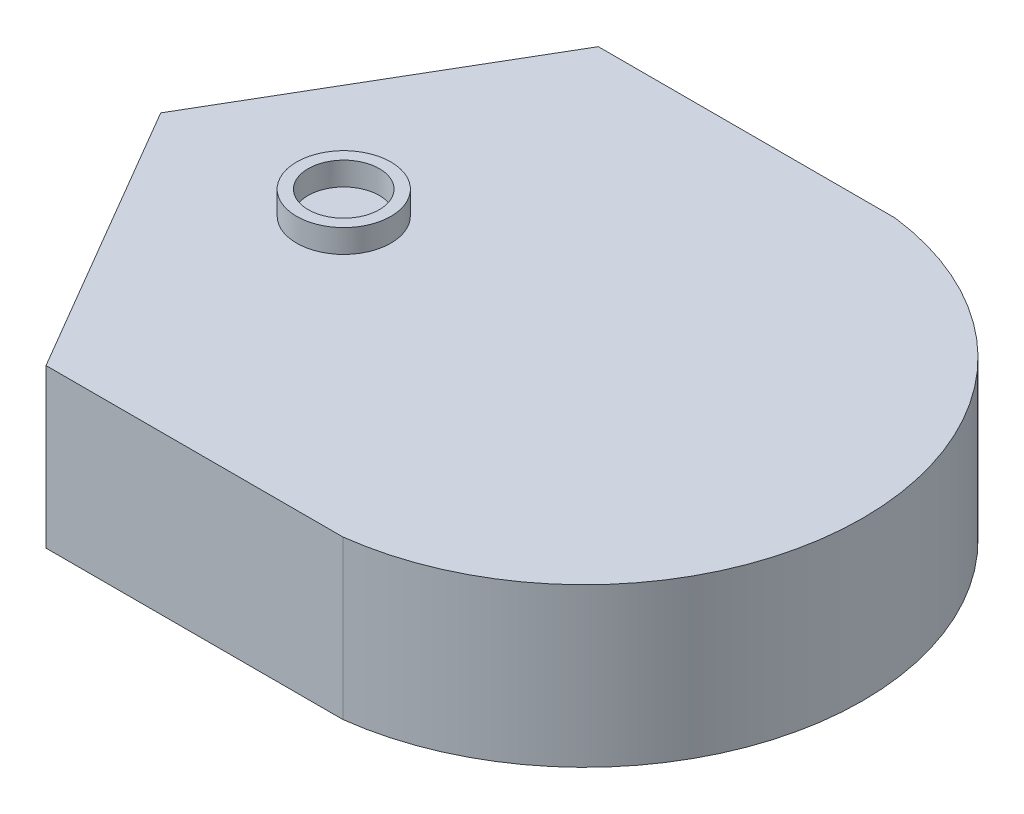
from build123d import *

# Parameters (mm, degrees)
SKETCH2_W            = 49
SKETCH2_H            = 20
BOSS_EXTRUDE1_DEPTH  = 10
SKETCH3_W            = 30
SKETCH3_H            = 3.02
CUT_EXTRUDE1_DEPTH   = 2
SKETCH4_W            = 5
SKETCH4_H            = 6
CUT_EXTRUDE2_DEPTH   = 5
SKETCH5_R            = 7
CUT_EXTRUDE3_DEPTH   = 38.474986727
SKETCH12_W           = 5
SKETCH12_H           = 6
BOSS_EXTRUDE4_DEPTH  = 0.8
SKETCH14_W           = 29.5
SKETCH14_H           = 6
CUT_EXTRUDE6_DEPTH   = 42.177221974
SKETCH20_W           = 5
SKETCH20_H           = 6
BOSS_EXTRUDE6_DEPTH  = 4.2
SKETCH21_R           = 4.6
CUT_EXTRUDE8_DEPTH   = 0.5
SKETCH22_R           = 3.825
CUT_EXTRUDE9_DEPTH   = 4
SKETCH24_R           = 4.6
SKETCH24_R_2         = 4.25
CUT_EXTRUDE11_DEPTH  = 1
BOSS_EXTRUDE9_START  = 8
SKETCH26_R           = 5.065639608
SKETCH26_R_2         = 3.825
BOSS_EXTRUDE9_DEPTH  = 8
SKETCH27_R           = 7
SKETCH27_R_2         = 4.6
CUT_EXTRUDE12_DEPTH  = 1
FILLET1_R            = 0.5
SKETCH56_R           = 2
CUT_EXTRUDE13_DEPTH  = 2
SKETCH57_W           = 3
SKETCH57_H           = 6
BOSS_EXTRUDE19_DEPTH = 5.3
CUT_EXTRUDE14_REACH  = 50.729
SKETCH58_R           = 1.5
FILLET2_R            = 0.3
FILLET3_R            = 0.8
SKETCH60_W           = 19
SKETCH60_H           = 4
BOSS_EXTRUDE21_DEPTH = 1
SKETCH59_W           = 22.86
SKETCH59_H           = 13
BOSS_EXTRUDE20_DEPTH = 11
CUT_EXTRUDE15_REACH  = 49.914
SKETCH61_R           = 2.5
FILLET4_R            = 4
BOSS_EXTRUDE22_DEPTH = 17


with BuildPart() as part:
    # Sketch2 → Boss-Extrude1 (new body)
    with BuildSketch(Plane(origin=(0, 0, 0), x_dir=(1, 0, 0), z_dir=(0, 1, 0))):
        with Locations((10.076923077, 3.557692308)):
            Rectangle(SKETCH2_W, SKETCH2_H)
    extrude(amount=BOSS_EXTRUDE1_DEPTH)

    # Sketch3 → Cut-Extrude1 (cut)
    with BuildSketch(Plane.XZ):
        with Locations((12.576923077, -3.557692308)):
            Rectangle(SKETCH3_W, SKETCH3_H)
    extrude(amount=-CUT_EXTRUDE1_DEPTH, mode=Mode.SUBTRACT)

    # Sketch4 → Cut-Extrude2 (cut)
    with BuildSketch(Plane.XZ):
        with Locations((-4.923076923, -3.547692308)):
            Rectangle(SKETCH4_W, SKETCH4_H)
    extrude(amount=-CUT_EXTRUDE2_DEPTH, mode=Mode.SUBTRACT)

    # Sketch5 → Cut-Extrude3 (cut, through all)
    with BuildSketch(Plane.XZ.offset(-5)):
        with Locations(Location((-4.923076923, -3.552692308, 0), (0, 0, 270))):
            Circle(SKETCH5_R)
    extrude(amount=-CUT_EXTRUDE3_DEPTH, mode=Mode.SUBTRACT)

    # Sketch12 → Boss-Extrude4 (add)
    with BuildSketch(Plane.XZ):
        with Locations((-4.923076923, -3.547692308)):
            Rectangle(SKETCH12_W, SKETCH12_H)
    extrude(amount=-BOSS_EXTRUDE4_DEPTH)

    # Sketch14 → Cut-Extrude6 (cut, through all)
    with BuildSketch(Plane.XY.offset(6.442307692)):
        with Locations((19.826923077, 7)):
            Rectangle(SKETCH14_W, SKETCH14_H)
    extrude(amount=-CUT_EXTRUDE6_DEPTH, mode=Mode.SUBTRACT)

    # Sketch20 → Boss-Extrude6 (add)
    with BuildSketch(Plane(origin=(0, 0.8, 0), x_dir=(1, 0, 0), z_dir=(0, 1, 0))):
        with Locations((-4.923076923, 3.547692308)):
            Rectangle(SKETCH20_W, SKETCH20_H)
    extrude(amount=BOSS_EXTRUDE6_DEPTH)

    # Sketch21 → Cut-Extrude8 (cut)
    with BuildSketch(Plane(origin=(0, 5, 0), x_dir=(1, 0, 0), z_dir=(0, 1, 0))):
        with Locations(Location((-4.923076923, 3.552692308, 0), (0, 0, 270))):
            Circle(SKETCH21_R)
    extrude(amount=-CUT_EXTRUDE8_DEPTH, mode=Mode.SUBTRACT)

    # Sketch22 → Cut-Extrude9 (cut)
    with BuildSketch(Plane(origin=(0, 4.5, 0), x_dir=(1, 0, 0), z_dir=(0, 1, 0))):
        with Locations(Location((-4.923076923, 3.552692308, 0), (0, 0, 270))):
            Circle(SKETCH22_R)
    extrude(amount=-CUT_EXTRUDE9_DEPTH, mode=Mode.SUBTRACT)

    # Sketch24 → Cut-Extrude11 (cut)
    with BuildSketch(Plane(origin=(0, 5, 0), x_dir=(1, 0, 0), z_dir=(0, 1, 0))):
        with Locations(Location((-4.923076923, 3.552692308, 0), (0, 0, 270))):
            Circle(SKETCH24_R)
        with Locations(Location((-4.923076923, 3.552692308, 0), (0, 0, 270))):
            Circle(SKETCH24_R_2, mode=Mode.SUBTRACT)
    extrude(amount=-CUT_EXTRUDE11_DEPTH, mode=Mode.SUBTRACT)

    # Sketch26 → Boss-Extrude9 (add)
    with BuildSketch(Plane(origin=(0, 4.5, 0), x_dir=(1, 0, 0), z_dir=(0, 1, 0)).offset(BOSS_EXTRUDE9_START)):
        with Locations(Location((-4.923076923, 3.552692308, 0), (0, 0, 90))):
            Circle(SKETCH26_R)
        with Locations(Location((-4.923076923, 3.552692308, 0), (0, 0, 270))):
            Circle(SKETCH26_R_2, mode=Mode.SUBTRACT)
    extrude(amount=-BOSS_EXTRUDE9_DEPTH)

    # Sketch27 → Cut-Extrude12 (cut)
    with BuildSketch(Plane(origin=(0, 5, 0), x_dir=(1, 0, 0), z_dir=(0, 1, 0))):
        with Locations(Location((-4.923076923, 3.552692308, 0), (0, 0, 90))):
            Circle(SKETCH27_R)
        with Locations(Location((-4.923076923, 3.552692308, 0), (0, 0, 270))):
            Circle(SKETCH27_R_2, mode=Mode.SUBTRACT)
    extrude(amount=-CUT_EXTRUDE12_DEPTH, mode=Mode.SUBTRACT)

    # Fillet1
    fillet1_edges = [part.edges().sort_by_distance(p)[0] for p in [
        (5.076923077, 4, -3.557692308),
    ]]
    fillet(fillet1_edges, radius=FILLET1_R)

    # Sketch56 → Cut-Extrude13 (cut)
    with BuildSketch(Plane.XZ):
        with Locations((28.926923077, -3.557692308)):
            Circle(SKETCH56_R)
    extrude(amount=-CUT_EXTRUDE13_DEPTH, mode=Mode.SUBTRACT)

    # Sketch57 → Boss-Extrude19 (add)
    with BuildSketch(Plane(origin=(0, 4, 0), x_dir=(1, 0, 0), z_dir=(0, 1, 0))):
        with Locations((29.181923077, 3.557692308)):
            Rectangle(SKETCH57_W, SKETCH57_H)
        with Locations((22.931923077, 3.557692308)):
            Rectangle(SKETCH57_W, SKETCH57_H)
    extrude(amount=BOSS_EXTRUDE19_DEPTH)

    # Cut-Extrude14: up to this face of the body (flat: up to its plane)
    cut_extrude14_end = Plane(part.part.faces().sort_by_distance((21.431923077, 6.65, -3.557692308))[0])
    # Sketch58 → Cut-Extrude14 (cut, up to the picked face)
    with BuildSketch(Plane(origin=(30.681923077, 0, 0), x_dir=(0, 0, -1), z_dir=(1, 0, 0)), mode=Mode.PRIVATE) as cut_extrude14_sk1:
        with Locations(Location((3.557692308, 7, 0), (0, 0, 180))):
            Circle(SKETCH58_R)
    cut_extrude14_tool1 = split(extrude(cut_extrude14_sk1.sketch, amount=-CUT_EXTRUDE14_REACH, mode=Mode.PRIVATE), bisect_by=cut_extrude14_end, keep=Keep.BOTH, mode=Mode.PRIVATE)
    add(cut_extrude14_tool1.solids().sort_by(Axis((30.681923, 7, -3.557692), (-1, 0, 0)))[0], mode=Mode.SUBTRACT)

    # Fillet2
    fillet2_edges = [part.edges().sort_by_distance(p)[0] for p in [
        (27.681923077, 9.3, -3.557692308),
        (24.431923077, 9.3, -3.557692308),
    ]]
    fillet(fillet2_edges, radius=FILLET2_R)

    # Fillet3
    fillet3_edges = [part.edges().sort_by_distance(p)[0] for p in [
        (30.681923077, 4, -3.557692308),
        (30.681923077, 6.65, -0.557692308),
        (29.181923077, 4, -6.557692308),
        (30.681923077, 6.65, -6.557692308),
        (29.181923077, 4, -0.557692308),
        (21.431923077, 6.65, -6.557692308),
        (21.431923077, 6.65, -0.557692308),
        (22.931923077, 4, -6.557692308),
        (21.431923077, 4, -3.557692308),
        (22.931923077, 4, -0.557692308),
    ]]
    fillet(fillet3_edges, radius=FILLET3_R)

    # Sketch60 → Boss-Extrude21 (add)
    with BuildSketch(Plane(origin=(0, 0, -13.557692308), x_dir=(-1, 0, 0), z_dir=(0, 0, -1))):
        with Locations((-25.076923077, 2)):
            Rectangle(SKETCH60_W, SKETCH60_H)
    boss_extrude21 = extrude(amount=BOSS_EXTRUDE21_DEPTH)

    # Sketch59 → Boss-Extrude20 (add)
    with BuildSketch(Plane(origin=(0, 0, -14.557692308), x_dir=(-1, 0, 0), z_dir=(0, 0, -1))):
        with Locations((-26.956923077, 3.5)):
            Rectangle(SKETCH59_W, SKETCH59_H)
    boss_extrude20 = extrude(amount=BOSS_EXTRUDE20_DEPTH)

    # Mirror4: Boss-Extrude21, Boss-Extrude20 across plane
    add(boss_extrude21.mirror(Plane(origin=(0, 0, -3.557692308), x_dir=(1, 0, 0), z_dir=(0, 0, -1))))
    add(boss_extrude20.mirror(Plane(origin=(0, 0, -3.557692308), x_dir=(1, 0, 0), z_dir=(0, 0, -1))))

    # Sketch61 → Cut-Extrude15 (cut, up to next)
    with BuildSketch(Plane(origin=(0, 10, 0), x_dir=(1, 0, 0), z_dir=(0, 1, 0)), mode=Mode.PRIVATE) as cut_extrude15_sk1:
        with Locations(Location((20.406923077, 20.207692308, 0), (0, 0, 270))):
            Circle(SKETCH61_R)
    cut_extrude15_tool1 = extrude(cut_extrude15_sk1.sketch, amount=-CUT_EXTRUDE15_REACH, mode=Mode.PRIVATE) & part.part
    # Sketch61 → Cut-Extrude15 (cut, up to next)
    with BuildSketch(Plane(origin=(0, 10, 0), x_dir=(1, 0, 0), z_dir=(0, 1, 0)), mode=Mode.PRIVATE) as cut_extrude15_sk2:
        with Locations(Location((31.706923077, 20.207692308, 0), (0, 0, 270))):
            Circle(SKETCH61_R)
    cut_extrude15_tool2 = extrude(cut_extrude15_sk2.sketch, amount=-CUT_EXTRUDE15_REACH, mode=Mode.PRIVATE) & part.part
    # Sketch61 → Cut-Extrude15 (cut, up to next)
    with BuildSketch(Plane(origin=(0, 10, 0), x_dir=(1, 0, 0), z_dir=(0, 1, 0)), mode=Mode.PRIVATE) as cut_extrude15_sk3:
        with Locations(Location((31.706923077, -13.092307692, 0), (0, 0, 90))):
            Circle(SKETCH61_R)
    cut_extrude15_tool3 = extrude(cut_extrude15_sk3.sketch, amount=-CUT_EXTRUDE15_REACH, mode=Mode.PRIVATE) & part.part
    # Sketch61 → Cut-Extrude15 (cut, up to next)
    with BuildSketch(Plane(origin=(0, 10, 0), x_dir=(1, 0, 0), z_dir=(0, 1, 0)), mode=Mode.PRIVATE) as cut_extrude15_sk4:
        with Locations(Location((20.406923077, -13.092307692, 0), (0, 0, 90))):
            Circle(SKETCH61_R)
    cut_extrude15_tool4 = extrude(cut_extrude15_sk4.sketch, amount=-CUT_EXTRUDE15_REACH, mode=Mode.PRIVATE) & part.part
    add(cut_extrude15_tool1.solids().sort_by_distance((20.406923, 10, -20.207692))[0], mode=Mode.SUBTRACT)
    add(cut_extrude15_tool2.solids().sort_by_distance((31.706923, 10, -20.207692))[0], mode=Mode.SUBTRACT)
    add(cut_extrude15_tool3.solids().sort_by_distance((31.706923, 10, 13.092308))[0], mode=Mode.SUBTRACT)
    add(cut_extrude15_tool4.solids().sort_by_distance((20.406923, 10, 13.092308))[0], mode=Mode.SUBTRACT)

    # Fillet4
    # the kernel refuses this fillet: 4 mm, written as the material it takes off along each edge
    with BuildSketch(Plane(origin=(38.386923077, 20, -25.557692308), x_dir=(0, 0, 1), z_dir=(0, -1, 0)), Plane(origin=(15.526923077, -13, -25.557692308), x_dir=(0, 0, 1), z_dir=(0, 1, 0)), Plane(origin=(15.526923077, -13, 18.442307692), x_dir=(1, 0, 0), z_dir=(0, 1, 0))) as fillet4_piece_1:
        with BuildLine():
            CenterArc((FILLET4_R, FILLET4_R), FILLET4_R, 180, 90)
            Line((0, FILLET4_R), (0, 0))
            Line((0, 0), (FILLET4_R, 0))
        make_face()
    extrude(amount=33, mode=Mode.SUBTRACT)
    with BuildSketch(Plane(origin=(38.386923077, 20, -14.557692308), x_dir=(-1, 0, 0), z_dir=(0, -1, 0))) as fillet4_piece_2_section:
        with BuildLine():
            CenterArc((FILLET4_R, FILLET4_R), FILLET4_R, 180, 90)
            Line((0, FILLET4_R), (0, 0))
            Line((0, 0), (FILLET4_R, 0))
        make_face()
    fillet4_piece_2 = extrude(amount=33, mode=Mode.PRIVATE)
    fillet4_piece_2 = split(fillet4_piece_2, bisect_by=Plane(origin=(34.576923077, 12, -14.51845576), z_dir=(-1, 0, 0)), keep=Keep.TOP, mode=Mode.PRIVATE)
    fillet4_piece_2 = split(fillet4_piece_2, bisect_by=Plane(origin=(34.482800084, 4, -14.51845576), z_dir=(0, 1, 0)), keep=Keep.TOP, mode=Mode.PRIVATE)
    add(fillet4_piece_2, mode=Mode.SUBTRACT)
    with BuildSketch(Plane(origin=(38.386923077, 20, -14.557692308), x_dir=(-1, 0, 0), z_dir=(0, -1, 0))) as fillet4_piece_3_section:
        with BuildLine():
            CenterArc((FILLET4_R, FILLET4_R), FILLET4_R, 180, 90)
            Line((0, FILLET4_R), (0, 0))
            Line((0, 0), (FILLET4_R, 0))
        make_face()
    fillet4_piece_3 = extrude(amount=33, mode=Mode.PRIVATE)
    fillet4_piece_3 = split(fillet4_piece_3, bisect_by=Plane(origin=(34.576923077, 12, -15.466872512), z_dir=(1, 0, 0)), keep=Keep.TOP, mode=Mode.PRIVATE)
    fillet4_piece_3 = split(fillet4_piece_3, bisect_by=Plane(origin=(37.49276705, 4, -15.466872512), z_dir=(0, 1, 0)), keep=Keep.TOP, mode=Mode.PRIVATE)
    add(fillet4_piece_3, mode=Mode.SUBTRACT)
    with BuildSketch(Plane(origin=(38.386923077, 20, -14.557692308), x_dir=(-1, 0, 0), z_dir=(0, -1, 0))) as fillet4_piece_4_section:
        with BuildLine():
            CenterArc((FILLET4_R, FILLET4_R), FILLET4_R, 180, 90)
            Line((0, FILLET4_R), (0, 0))
            Line((0, 0), (FILLET4_R, 0))
        make_face()
    fillet4_piece_4 = extrude(amount=33, mode=Mode.PRIVATE)
    fillet4_piece_4 = split(fillet4_piece_4, bisect_by=Plane(origin=(34.576923077, 2, -15.466872512), z_dir=(1, 0, 0)), keep=Keep.TOP, mode=Mode.PRIVATE)
    fillet4_piece_4 = split(fillet4_piece_4, bisect_by=Plane(origin=(37.49276705, 0, -15.466872512), z_dir=(0, 1, 0)), keep=Keep.TOP, mode=Mode.PRIVATE)
    fillet4_piece_4 = split(fillet4_piece_4, bisect_by=Plane(origin=(37.49276705, 4, -15.466872512), z_dir=(0, -1, 0)), keep=Keep.TOP, mode=Mode.PRIVATE)
    add(fillet4_piece_4, mode=Mode.SUBTRACT)
    with BuildSketch(Plane(origin=(38.386923077, 20, -14.557692308), x_dir=(-1, 0, 0), z_dir=(0, -1, 0))) as fillet4_piece_5_section:
        with BuildLine():
            CenterArc((FILLET4_R, FILLET4_R), FILLET4_R, 180, 90)
            Line((0, FILLET4_R), (0, 0))
            Line((0, 0), (FILLET4_R, 0))
        make_face()
    fillet4_piece_5 = extrude(amount=33, mode=Mode.PRIVATE)
    fillet4_piece_5 = split(fillet4_piece_5, bisect_by=Plane(origin=(34.576923077, -6.5, -14.51845576), z_dir=(-1, 0, 0)), keep=Keep.TOP, mode=Mode.PRIVATE)
    fillet4_piece_5 = split(fillet4_piece_5, bisect_by=Plane(origin=(34.482800084, 0, -14.51845576), z_dir=(0, -1, 0)), keep=Keep.TOP, mode=Mode.PRIVATE)
    add(fillet4_piece_5, mode=Mode.SUBTRACT)
    with BuildSketch(Plane(origin=(38.386923077, 20, -14.557692308), x_dir=(-1, 0, 0), z_dir=(0, -1, 0))) as fillet4_piece_6_section:
        with BuildLine():
            CenterArc((FILLET4_R, FILLET4_R), FILLET4_R, 180, 90)
            Line((0, FILLET4_R), (0, 0))
            Line((0, 0), (FILLET4_R, 0))
        make_face()
    fillet4_piece_6 = extrude(amount=33, mode=Mode.PRIVATE)
    fillet4_piece_6 = split(fillet4_piece_6, bisect_by=Plane(origin=(34.576923077, -6.5, -15.466872512), z_dir=(1, 0, 0)), keep=Keep.TOP, mode=Mode.PRIVATE)
    fillet4_piece_6 = split(fillet4_piece_6, bisect_by=Plane(origin=(37.49276705, 0, -15.466872512), z_dir=(0, -1, 0)), keep=Keep.TOP, mode=Mode.PRIVATE)
    add(fillet4_piece_6, mode=Mode.SUBTRACT)
    with BuildSketch(Plane(origin=(38.386923077, 20, 7.442307692), x_dir=(0, 0, 1), z_dir=(0, -1, 0))) as fillet4_piece_7_section:
        with BuildLine():
            CenterArc((FILLET4_R, FILLET4_R), FILLET4_R, 180, 90)
            Line((0, FILLET4_R), (0, 0))
            Line((0, 0), (FILLET4_R, 0))
        make_face()
    fillet4_piece_7 = extrude(amount=33, mode=Mode.PRIVATE)
    fillet4_piece_7 = split(fillet4_piece_7, bisect_by=Plane(origin=(34.576923077, 12, 8.351487897), z_dir=(1, 0, 0)), keep=Keep.TOP, mode=Mode.PRIVATE)
    fillet4_piece_7 = split(fillet4_piece_7, bisect_by=Plane(origin=(37.49276705, 4, 8.351487897), z_dir=(0, 1, 0)), keep=Keep.TOP, mode=Mode.PRIVATE)
    add(fillet4_piece_7, mode=Mode.SUBTRACT)
    with BuildSketch(Plane(origin=(38.386923077, 20, 7.442307692), x_dir=(0, 0, 1), z_dir=(0, -1, 0))) as fillet4_piece_8_section:
        with BuildLine():
            CenterArc((FILLET4_R, FILLET4_R), FILLET4_R, 180, 90)
            Line((0, FILLET4_R), (0, 0))
            Line((0, 0), (FILLET4_R, 0))
        make_face()
    fillet4_piece_8 = extrude(amount=33, mode=Mode.PRIVATE)
    fillet4_piece_8 = split(fillet4_piece_8, bisect_by=Plane(origin=(34.576923077, 12, 7.403071145), z_dir=(-1, 0, 0)), keep=Keep.TOP, mode=Mode.PRIVATE)
    fillet4_piece_8 = split(fillet4_piece_8, bisect_by=Plane(origin=(34.482800084, 4, 7.403071145), z_dir=(0, 1, 0)), keep=Keep.TOP, mode=Mode.PRIVATE)
    add(fillet4_piece_8, mode=Mode.SUBTRACT)
    with BuildSketch(Plane(origin=(38.386923077, 20, 7.442307692), x_dir=(0, 0, 1), z_dir=(0, -1, 0))) as fillet4_piece_9_section:
        with BuildLine():
            CenterArc((FILLET4_R, FILLET4_R), FILLET4_R, 180, 90)
            Line((0, FILLET4_R), (0, 0))
            Line((0, 0), (FILLET4_R, 0))
        make_face()
    fillet4_piece_9 = extrude(amount=33, mode=Mode.PRIVATE)
    fillet4_piece_9 = split(fillet4_piece_9, bisect_by=Plane(origin=(34.576923077, 2, 8.351487897), z_dir=(1, 0, 0)), keep=Keep.TOP, mode=Mode.PRIVATE)
    fillet4_piece_9 = split(fillet4_piece_9, bisect_by=Plane(origin=(37.49276705, 0, 8.351487897), z_dir=(0, 1, 0)), keep=Keep.TOP, mode=Mode.PRIVATE)
    fillet4_piece_9 = split(fillet4_piece_9, bisect_by=Plane(origin=(37.49276705, 4, 8.351487897), z_dir=(0, -1, 0)), keep=Keep.TOP, mode=Mode.PRIVATE)
    add(fillet4_piece_9, mode=Mode.SUBTRACT)
    with BuildSketch(Plane(origin=(38.386923077, 20, 7.442307692), x_dir=(0, 0, 1), z_dir=(0, -1, 0))) as fillet4_piece_10_section:
        with BuildLine():
            CenterArc((FILLET4_R, FILLET4_R), FILLET4_R, 180, 90)
            Line((0, FILLET4_R), (0, 0))
            Line((0, 0), (FILLET4_R, 0))
        make_face()
    fillet4_piece_10 = extrude(amount=33, mode=Mode.PRIVATE)
    fillet4_piece_10 = split(fillet4_piece_10, bisect_by=Plane(origin=(34.576923077, -6.5, 8.351487897), z_dir=(1, 0, 0)), keep=Keep.TOP, mode=Mode.PRIVATE)
    fillet4_piece_10 = split(fillet4_piece_10, bisect_by=Plane(origin=(37.49276705, 0, 8.351487897), z_dir=(0, -1, 0)), keep=Keep.TOP, mode=Mode.PRIVATE)
    add(fillet4_piece_10, mode=Mode.SUBTRACT)
    with BuildSketch(Plane(origin=(38.386923077, 20, 7.442307692), x_dir=(0, 0, 1), z_dir=(0, -1, 0))) as fillet4_piece_11_section:
        with BuildLine():
            CenterArc((FILLET4_R, FILLET4_R), FILLET4_R, 180, 90)
            Line((0, FILLET4_R), (0, 0))
            Line((0, 0), (FILLET4_R, 0))
        make_face()
    fillet4_piece_11 = extrude(amount=33, mode=Mode.PRIVATE)
    fillet4_piece_11 = split(fillet4_piece_11, bisect_by=Plane(origin=(34.576923077, -6.5, 7.403071145), z_dir=(-1, 0, 0)), keep=Keep.TOP, mode=Mode.PRIVATE)
    fillet4_piece_11 = split(fillet4_piece_11, bisect_by=Plane(origin=(34.482800084, 0, 7.403071145), z_dir=(0, -1, 0)), keep=Keep.TOP, mode=Mode.PRIVATE)
    add(fillet4_piece_11, mode=Mode.SUBTRACT)
    with BuildSketch(Plane(origin=(38.386923077, 20, 18.442307692), x_dir=(0, 0, -1), z_dir=(0, -1, 0))) as fillet4_piece_12:
        with BuildLine():
            CenterArc((FILLET4_R, -FILLET4_R), FILLET4_R, 90, 90)
            Line((0, -FILLET4_R), (0, 0))
            Line((0, 0), (FILLET4_R, 0))
        make_face()
    extrude(amount=33, mode=Mode.SUBTRACT)
    with BuildSketch(Plane(origin=(-14.423076923, -10, 6.442307692), x_dir=(1, 0, 0), z_dir=(0, 1, 0))) as fillet4_piece_13:
        with BuildLine():
            CenterArc((FILLET4_R, FILLET4_R), FILLET4_R, 180, 90)
            Line((0, FILLET4_R), (0, 0))
            Line((0, 0), (FILLET4_R, 0))
        make_face()
    extrude(amount=30, mode=Mode.SUBTRACT)
    with BuildSketch(Plane(origin=(-14.423076923, -10, -13.557692308), x_dir=(1, 0, 0), z_dir=(0, 1, 0))) as fillet4_piece_14:
        with BuildLine():
            CenterArc((FILLET4_R, -FILLET4_R), FILLET4_R, 90, 90)
            Line((0, -FILLET4_R), (0, 0))
            Line((0, 0), (FILLET4_R, 0))
        make_face()
    extrude(amount=30, mode=Mode.SUBTRACT)

    # Sketch62 → Boss-Extrude22 (add)
    with BuildSketch(Plane(origin=(0, 10, 0), x_dir=(1, 0, 0), z_dir=(0, 1, 0))):
        with BuildLine():
            Line((-24.361726951, 3.314545782), (-7.005211005, -26.372589568))
            Line((-7.005211005, -26.372589568), (24.899678694, -26.372589568))
            ThreePointArc((24.899678694, -26.372589568), (51.103814887, 3.314545782), (24.899678694, 33.001681131))
            Line((24.899678694, 33.001681131), (-7.005211005, 33.001681131))
            Line((-7.005211005, 33.001681131), (-24.361726951, 3.314545782))
        make_face()
    extrude(amount=-BOSS_EXTRUDE22_DEPTH)


solid = part.part
